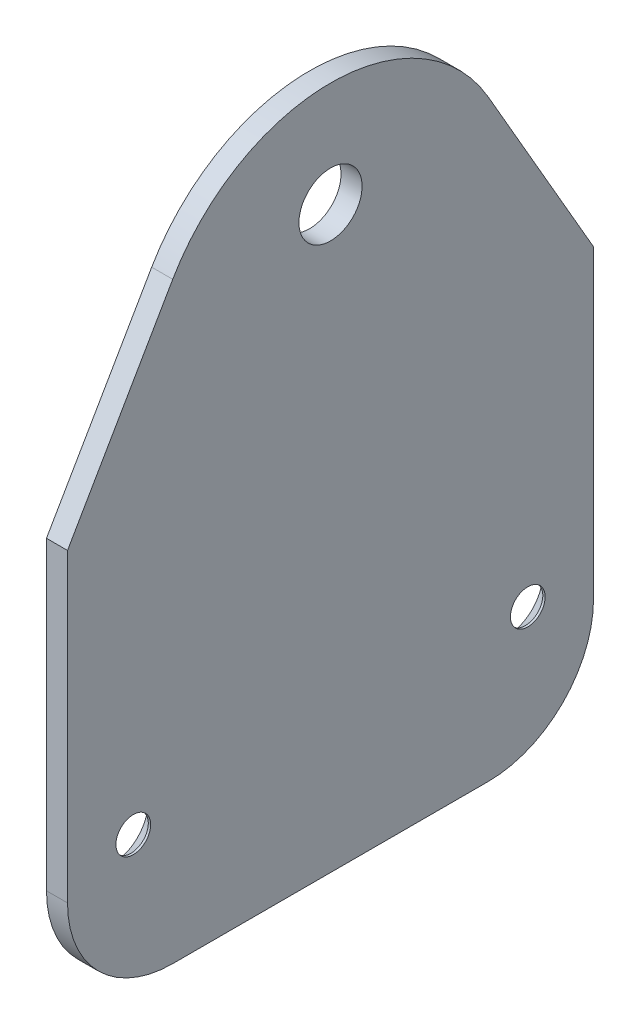
from build123d import *

# Parameters (mm, degrees)
SKETCH_10_W                = 100
SKETCH_10_H                = 130
SM_BASE_FLANGE_1_DEPTH     = 4
SKETCH_13_R                = 6
CUT_EXTRUDE_1_DEPTH        = 10
HOLE_WIZARD_M61_AT_2_COUNT = 2
HOLE_WIZARD_M61_AT_2_PITCH = 75
CHAMFER_1_SIZE             = 30
CHAMFER_1_SIZE2            = 51.961524227
FILLET_1_R                 = 34.641016
FILLET_2_R                 = 20


# Sheet-metal steps are written as plain solids
with BuildPart() as part:
    # Эскиз10 → Базовая кромка1 (new body)
    with BuildSketch(Plane(origin=(0, 0, 0), x_dir=(0, 0, -1), z_dir=(1, 0, 0))):
        with Locations((0, 65)):
            Rectangle(SKETCH_10_W, SKETCH_10_H)
    extrude(amount=-SM_BASE_FLANGE_1_DEPTH)

    # Эскиз13 → Вырез-Вытянуть1 (cut)
    with BuildSketch(Plane.ZY.offset(4)):
        with Locations((0, 110)):
            Circle(SKETCH_13_R)
    extrude(amount=-CUT_EXTRUDE_1_DEPTH, mode=Mode.SUBTRACT)

    # Эскиз16 → Зенковка для винта с потайной головкой и внутренним шестигранником M61 (revolve, cut)
    with BuildSketch(Plane(origin=(-4, 25, -37.5), x_dir=(0, 0, 1), z_dir=(0, 1, 0))):
        Polygon((0, 0), (0, 4), (3.3, 4), (3.3, 3.555), (6.855, 0), align=None)
    hole_wizard_m61 = revolve(axis=Axis((-10.35, 25, -37.5), (1, 0, 0)), mode=Mode.SUBTRACT)

    # Зенковка для винта с потайной головкой и внутренним шестигранником M61 at 2: Зенковка для винта с потайной головкой и внутренним шестигранником M61 ×2
    with Locations(*[(0, 0, i * HOLE_WIZARD_M61_AT_2_PITCH) for i in range(1, HOLE_WIZARD_M61_AT_2_COUNT)]):
        add(hole_wizard_m61, mode=Mode.SUBTRACT)

    # Фаска1
    chamfer_1_edges = [part.edges().sort_by_distance(p)[0] for p in [
        (-2, 130, 50),
        (-2, 130, -50),
    ]]
    chamfer_1_side = [part.faces().sort_by_distance(p)[0] for p in [
        (-2, 130, 0),
    ]]
    chamfer(chamfer_1_edges, length=CHAMFER_1_SIZE, length2=CHAMFER_1_SIZE2, reference=chamfer_1_side[0])

    # Скругление1
    fillet_1_edges = [part.edges().sort_by_distance(p)[0] for p in [
        (-2, 130, -20),
        (-2, 130, 20),
    ]]
    fillet(fillet_1_edges, radius=FILLET_1_R)

    # Скругление2
    fillet_2_edges = [part.edges().sort_by_distance(p)[0] for p in [
        (-2, 0, -50),
        (-2, 0, 50),
    ]]
    fillet(fillet_2_edges, radius=FILLET_2_R)


solid = part.part
